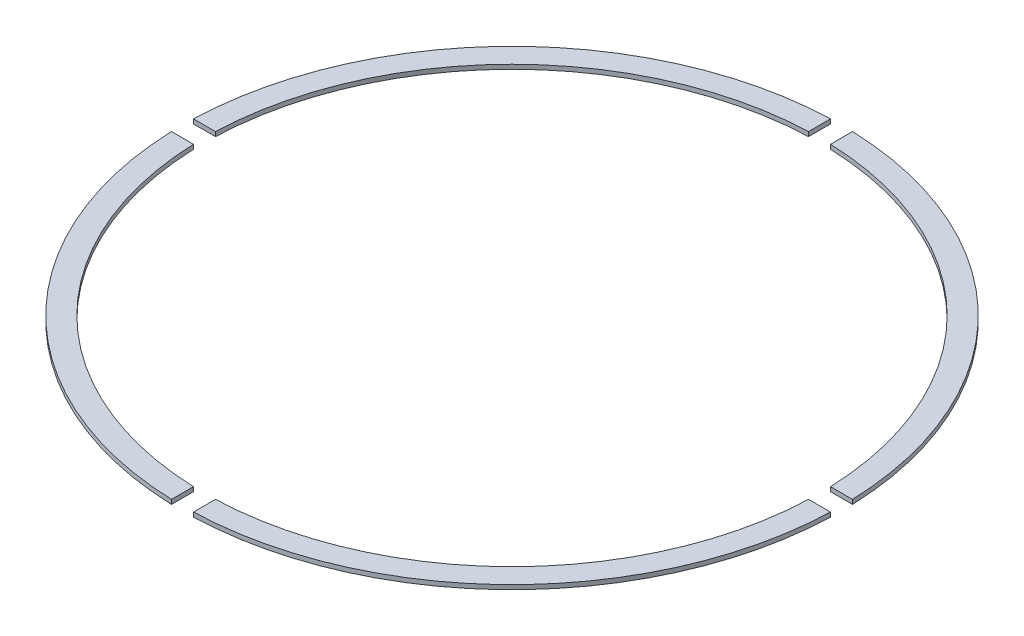
from build123d import *

# Parameters (mm, degrees)
SKETCH1_R           = 225
SKETCH1_R_2         = 210
BOSS_EXTRUDE1_DEPTH = 1.5
SKETCH2_W           = 56.300564526
SKETCH2_H           = 15
CUT_EXTRUDE1_DEPTH  = 319.201587048
CIRPATTERN1_COUNT   = 4


with BuildPart() as part:
    # Sketch1 → Boss-Extrude1 (new, symmetric)
    with BuildSketch(Plane(origin=(0, 0, 0), x_dir=(1, 0, 0), z_dir=(0, 1, 0))):
        Circle(SKETCH1_R)
        Circle(SKETCH1_R_2, mode=Mode.SUBTRACT)
    extrude(amount=BOSS_EXTRUDE1_DEPTH, both=True)

    # Sketch2 → Cut-Extrude1 (cut, symmetric)
    with BuildSketch(Plane(origin=(0, 0, 0), x_dir=(1, 0, 0), z_dir=(0, 1, 0))):
        with Locations((217.5, 0)):
            Rectangle(SKETCH2_W, SKETCH2_H)
    cut_extrude1 = extrude(amount=CUT_EXTRUDE1_DEPTH, both=True, mode=Mode.SUBTRACT)

    # CirPattern1: Cut-Extrude1 ×4 about axis
    cirpattern1_axis = Axis((0, 175.232087235, 0), (0, -1, 0))
    for i in range(1, CIRPATTERN1_COUNT):
        add(cut_extrude1.rotate(cirpattern1_axis, i * 360 / CIRPATTERN1_COUNT), mode=Mode.SUBTRACT)


solid = part.part
